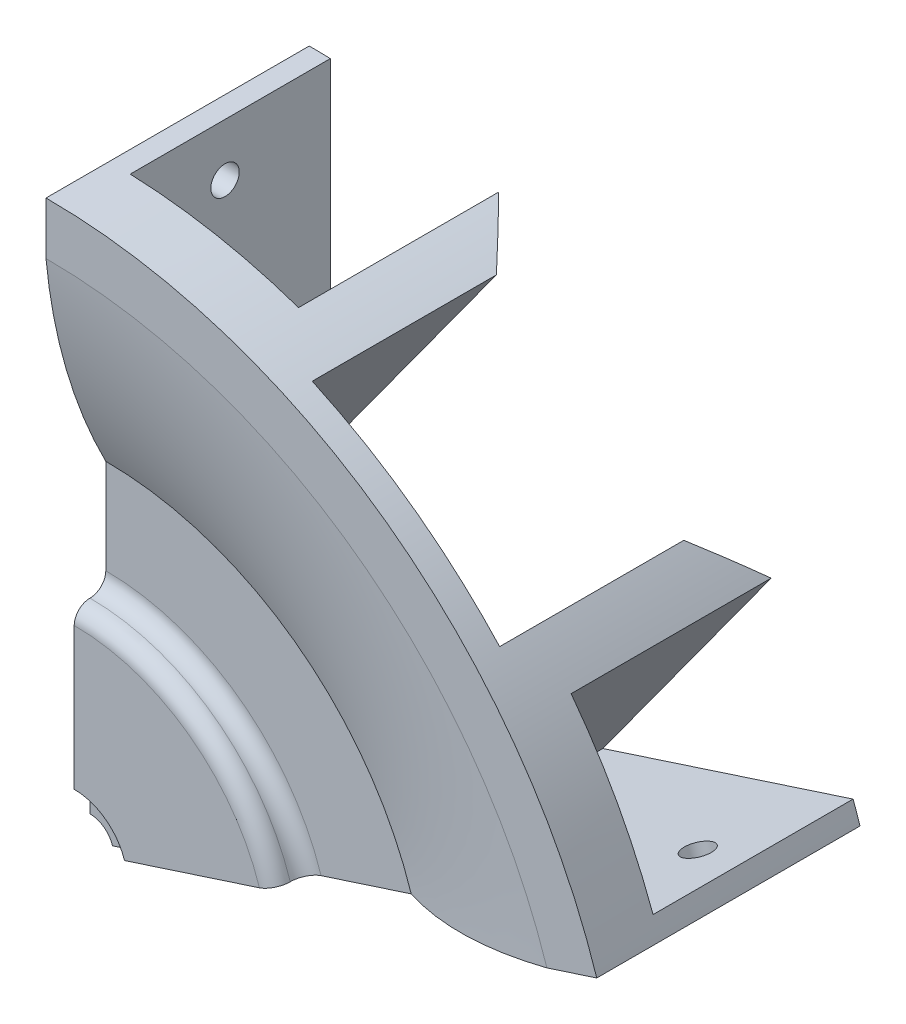
from build123d import *

# Parameters (mm, degrees)
EXTRUDE_1_DEPTH          = 50
CUT_EXTRUDE_1_DEPTH      = 22
CUT_EXTRUDE_1_DEPTH_BACK = 22
CHAMFER_1_SIZE           = 10
CUT_EXTRUDE_4_DEPTH      = 38
SKETCH_7_R               = 2.7
CUT_EXTRUDE_5_DEPTH      = 158.237473694
SKETCH_12_W              = 10.5
SKETCH_12_H              = 10.5
CUT_EXTRUDE_8_DEPTH      = 4
SKETCH_13_W              = 10
SKETCH_13_H              = 10
EXTRUDE_3_DEPTH          = 3.5
EXTRUDE_4_DEPTH          = 6
SKETCH_16_R              = 10.05
CUT_EXTRUDE_11_DEPTH     = 3
SKETCH_17_R              = 4.5
CUT_EXTRUDE_12_DEPTH     = 158.41319251
SKETCH_18_R              = 30
CUT_EXTRUDE_13_DEPTH     = 6
FILLET_1_2_ANGLE         = 72
FILLET_1_3_ANGLE         = 72
FILLET_1_4_ANGLE         = 72


with BuildPart() as part:
    # 草图1 → 凸台-拉伸1 (new body)
    with BuildSketch(Plane.XY):
        with BuildLine():
            Line((0, 0), (0, 110))
            ThreePointArc((0, 110), (64.656377752, 88.991869381), (104.616216792, 33.991869381))
            Line((104.616216792, 33.991869381), (0, 0))
        make_face()
    extrude(amount=EXTRUDE_1_DEPTH)

    # 草图2 → 切除-拉伸1 (cut, two sides: drawn at the far end of the back side and taken through both)
    with BuildSketch(Plane(origin=(0, 0, 0), x_dir=(0, 0, 1), z_dir=(-0.8090169943749467, 0.5877852522924744, 0)).offset(-CUT_EXTRUDE_1_DEPTH_BACK)):
        with BuildLine():
            Line((-2.434479972, 121.031505263), (-32.434479972, 60.021300119))
            ThreePointArc((-32.434479972, 60.021300119), (-25.826576487, 29.63728916), (5.26447133, 29.190908144))
            ThreePointArc((5.26447133, 29.190908144), (34.528838333, 64.97494707), (45, 110))
            ThreePointArc((45, 110), (25.662949792, 134.35017453), (-2.434479972, 121.031505263))
        make_face()
    extrude(amount=CUT_EXTRUDE_1_DEPTH + CUT_EXTRUDE_1_DEPTH_BACK, mode=Mode.SUBTRACT)

    # 倒角1
    # the kernel refuses this chamfer: 10 mm, written as the material it takes off along each edge
    with BuildSketch(Plane(origin=(-15.115973339, 16.623283153, 0), x_dir=(0, 0, 1), z_dir=(0.5877852522924744, 0.8090169943749467, 0))) as chamfer_1_piece_1_section:
        Polygon((CHAMFER_1_SIZE, 0), (0, -CHAMFER_1_SIZE), (0, 0), align=None)
    chamfer_1_piece_1 = extrude(amount=128.930806191, mode=Mode.PRIVATE)
    chamfer_1_piece_1 = chamfer_1_piece_1 & Plane(origin=(46.858003876, 101.923144932, -57.037418863), x_dir=(-0.4654997448337989, -0.6407054327731835, 0.6105788531996469), z_dir=(0.8090169943749466, -0.5877852522924744, 0)) * Cylinder(102.037418863, 298, mode=Mode.PRIVATE)
    add(chamfer_1_piece_1, mode=Mode.SUBTRACT)
    with BuildSketch(Plane(origin=(20.480774414, -9.239267947, 0), x_dir=(0, 0, 1), z_dir=(0.5877852522924744, 0.8090169943749467, 0))) as chamfer_1_piece_2_section:
        Polygon((CHAMFER_1_SIZE, 0), (0, CHAMFER_1_SIZE), (0, 0), align=None)
    chamfer_1_piece_2 = extrude(amount=128.930806191, mode=Mode.PRIVATE)
    chamfer_1_piece_2 = chamfer_1_piece_2 & Plane(origin=(82.454751628, 76.060593831, -57.037418863), x_dir=(-0.4654997448337989, -0.6407054327731835, 0.6105788531996469), z_dir=(0.8090169943749466, -0.5877852522924744, 0)) * Cylinder(102.037418863, 298, mode=Mode.PRIVATE)
    add(chamfer_1_piece_2, mode=Mode.SUBTRACT)

    # 草图5 → 切除-旋转2 (revolve, cut)
    with BuildSketch(Plane(origin=(0, 0, 0), x_dir=(0, 0, 1), z_dir=(-0.8090169943749467, 0.5877852522924744, 0))):
        with BuildLine():
            Line((38.64565174, 61), (38.64565174, 0))
            Line((38.64565174, 0), (50.462581137, 0))
            Line((50.462581137, 0), (50.462581137, 110))
            ThreePointArc((50.462581137, 110), (47.466600414, 84.797620051), (38.64565174, 61))
        make_face()
        with BuildLine():
            Line((-5, 24), (-5, 0))
            Line((-5, 0), (33.64565174, 0))
            Line((33.64565174, 0), (33.64565174, 52.269326125))
            ThreePointArc((33.64565174, 52.269326125), (21.831047905, 36.951968201), (7.462581137, 24))
            Line((7.462581137, 24), (-5, 24))
        make_face()
    revolve(axis=Axis((0, 0, -7.898129057), (0, 0, 1)), mode=Mode.SUBTRACT)

    # 草图6 → 切除-拉伸4 (cut)
    with BuildSketch(Plane(origin=(0, 0, 0), x_dir=(-1, 0, 0), z_dir=(0, 0, -1))):
        Polygon((-4, 59.947179416), (-4, 121.087474703), (-38.681182805, 107.68173241), align=None)
        Polygon((-90.458270445, 70.063476264), (-113.924963881, 41.222313554), (-55.77708764, 22.32892327), align=None)
    extrude(amount=-CUT_EXTRUDE_4_DEPTH, mode=Mode.SUBTRACT)

    # 草图7 → 切除-拉伸5 (cut, through all)
    with BuildSketch(Plane(origin=(4, 0, 0), x_dir=(0, 0, -1), z_dir=(1, 0, 0))):
        with Locations((-20, 99.927248669)):
            Circle(SKETCH_7_R)
        with Locations((-20, 74.927248669)):
            Circle(SKETCH_7_R)
    cut_extrude_5 = extrude(amount=-CUT_EXTRUDE_5_DEPTH, mode=Mode.SUBTRACT)

    # 镜向1: 切除-拉伸5 across plane
    add(cut_extrude_5.mirror(Plane(origin=(0, 0, 0), x_dir=(0, 0, 1), z_dir=(-0.8090169943749466, 0.5877852522924742, 0))), mode=Mode.SUBTRACT)

    # 草图12 → 切除-拉伸8 (cut)
    with BuildSketch(Plane.ZY):
        with Locations((20, 55)):
            Rectangle(SKETCH_12_W, SKETCH_12_H)
    extrude(amount=-CUT_EXTRUDE_8_DEPTH, mode=Mode.SUBTRACT)

    # 草图13 → 凸台-拉伸3 (add)
    with BuildSketch(Plane(origin=(0, 0, 0), x_dir=(0.9510565162951544, 0.30901699437494484, 0), z_dir=(0.30901699437494484, -0.9510565162951544, 0))):
        with Locations((55, 20)):
            Rectangle(SKETCH_13_W, SKETCH_13_H)
    extrude(amount=EXTRUDE_3_DEPTH)

    # 草图14 → 凸台-拉伸4 (add)
    with BuildSketch(Plane.XY.offset(38.64565174)):
        with BuildLine():
            Line((0, 0), (0, 40))
            ThreePointArc((0, 40), (23.511410092, 32.360679775), (38.042260652, 12.360679775))
            Line((38.042260652, 12.360679775), (0, 0))
        make_face()
    extrude(amount=EXTRUDE_4_DEPTH)

    # 草图16 → 切除-拉伸11 (cut)
    with BuildSketch(Plane.XY.offset(44.64565174)):
        Circle(SKETCH_16_R)
    extrude(amount=-CUT_EXTRUDE_11_DEPTH, mode=Mode.SUBTRACT)

    # 草图17 → 切除-拉伸12 (cut, through all)
    with BuildSketch(Plane.XY.offset(41.64565174)):
        Circle(SKETCH_17_R)
    extrude(amount=-CUT_EXTRUDE_12_DEPTH, mode=Mode.SUBTRACT)

    # 草图18 → 切除-拉伸13 (cut)
    with BuildSketch(Plane(origin=(0, 0, 33.64565174), x_dir=(-1, 0, 0), z_dir=(0, 0, -1))):
        Circle(SKETCH_18_R)
    extrude(amount=-CUT_EXTRUDE_13_DEPTH, mode=Mode.SUBTRACT)

    # 圆角1: read off the stored shape, not the designer's step
    # 圆角1 outline → 圆角1 (revolve, cut)
    with BuildSketch(Plane.XZ):
        with BuildLine():
            ThreePointArc((30, 36.64565174), (29.802517077, 37.716118009), (29.236067978, 38.64565174))
            Line((29.236067978, 38.64565174), (27, 38.64565174))
            Line((27, 38.64565174), (27, 33.64565174))
            Line((27, 33.64565174), (33, 33.64565174))
            ThreePointArc((33, 33.64565174), (30.878679657, 34.524331396), (30, 36.64565174))
        make_face()
    revolve(axis=Axis((0, 0, 0), (0, 0, 1)), mode=Mode.SUBTRACT)

    # Fillet 1 2 outline → Fillet 1 2 (revolve)
    with BuildSketch(Plane(origin=(0, 0, 0), x_dir=(0.9510565162951545, 0.30901699437494434, 0), z_dir=(0.30901699437494434, -0.9510565162951545, 0))):
        with BuildLine():
            Line((30, 39.64565174), (27, 39.64565174))
            ThreePointArc((27, 39.64565174), (29.121320344, 38.766972084), (30, 36.64565174))
            Line((30, 36.64565174), (30, 39.64565174))
        make_face()
    revolve(axis=Axis((0, 0, 0), (0, 0, 1)), revolution_arc=FILLET_1_2_ANGLE)

    # Fillet 1 3 outline → Fillet 1 3 (revolve)
    with BuildSketch(Plane(origin=(0, 0, 0), x_dir=(0.9510565162951548, 0.30901699437494395, 0), z_dir=(0.30901699437494395, -0.9510565162951548, 0))):
        with BuildLine():
            ThreePointArc((43, 38.64565174), (40.878679657, 39.524331397), (40, 41.64565174))
            ThreePointArc((40, 41.64565174), (39.121320344, 43.766972084), (37, 44.64565174))
            Line((37, 44.64565174), (37, 38.64565174))
            Line((37, 38.64565174), (43, 38.64565174))
        make_face()
    revolve(axis=Axis((0, 0, 0), (0, 0, 1)), revolution_arc=FILLET_1_3_ANGLE)

    # Fillet 1 4 outline → Fillet 1 4 (revolve, cut)
    with BuildSketch(Plane(origin=(0, 0, 0), x_dir=(0.9510565162951548, 0.30901699437494395, 0), z_dir=(0.30901699437494395, -0.9510565162951548, 0))):
        with BuildLine():
            ThreePointArc((37, 44.64565174), (39.121320344, 43.766972084), (40, 41.64565174))
            ThreePointArc((40, 41.64565174), (40.878679657, 39.524331397), (43, 38.64565174))
            Line((43, 38.64565174), (43, 44.64565174))
            Line((43, 44.64565174), (37, 44.64565174))
        make_face()
    revolve(axis=Axis((0, 0, 0), (0, 0, 1)), revolution_arc=FILLET_1_4_ANGLE, mode=Mode.SUBTRACT)


solid = part.part
